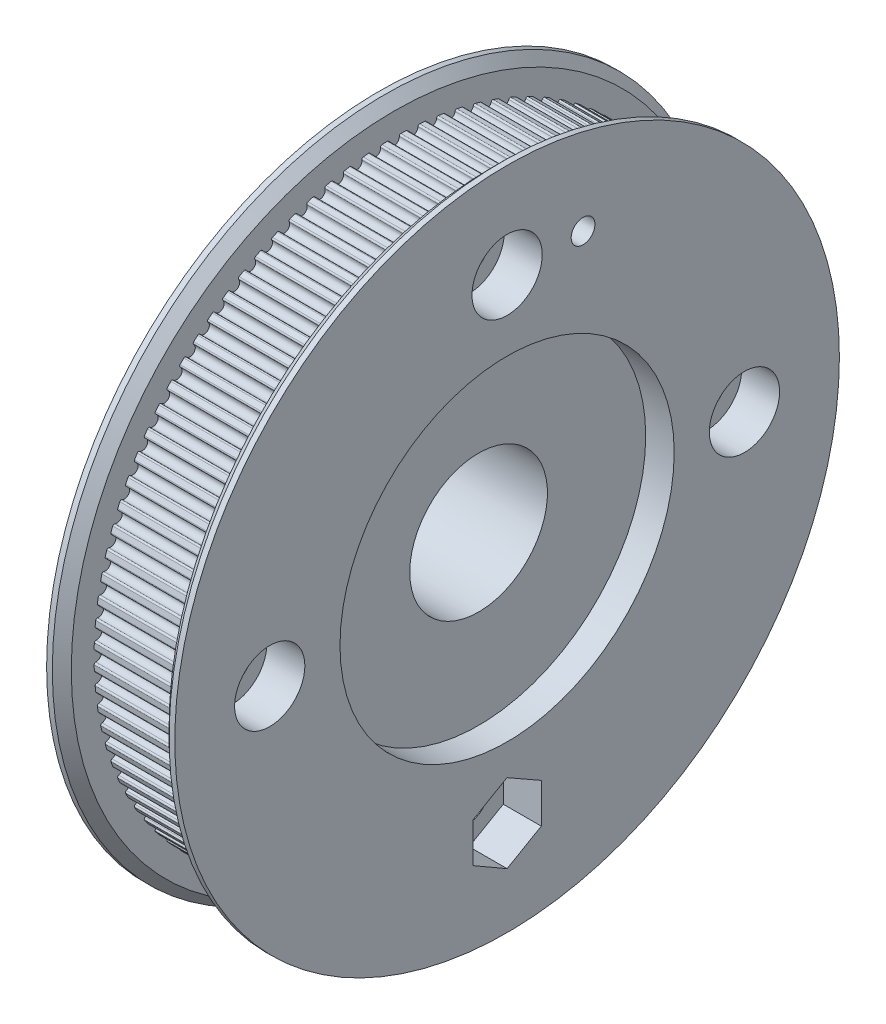
from build123d import *

# Parameters (mm, degrees)
SKETCH1_R           = 31.6
SKETCH1_R_2         = 7.25
BOSS_EXTRUDE1_DEPTH = 10.3
SKETCH2_R           = 0.55
CUT_EXTRUDE1_DEPTH  = 10.3
FILLET1_R           = 0.16
SKETCH3_R           = 35
SKETCH3_R_2         = 7.25
BOSS_EXTRUDE2_DEPTH = 1.6
SKETCH7_R           = 3.7
CUT_EXTRUDE4_DEPTH  = 4
CHAMFER1_SIZE       = 1
SKETCH8_R           = 17.6
CUT_EXTRUDE7_DEPTH  = 3
EXTRUDE_START       = 1.6
SKETCH_1_R          = 35
EXTRUDE_1_DEPTH     = 1.6
CHAMFER_1_SIZE      = 1
SKETCH_2_R          = 2
SKETCH_2_R_2        = 7.25
SKETCH_2_R_3        = 1.25
CUT_EXTRUDE_1_DEPTH = 52.305457799


with BuildPart() as part:
    # Sketch1 → Boss-Extrude1 (new body)
    with BuildSketch(Plane(origin=(0, 0, 0), x_dir=(0, 0, -1), z_dir=(1, 0, 0))):
        with Locations(Location((0, 0, 0), (0, 0, 180))):
            Circle(SKETCH1_R)
        with Locations(Location((0, 0, 0), (0, 0, 180))):
            Circle(SKETCH1_R_2, mode=Mode.SUBTRACT)
    extrude(amount=BOSS_EXTRUDE1_DEPTH)

    # Sketch2 → Cut-Extrude1 (cut)
    with BuildSketch(Plane(origin=(0, 0, 0), x_dir=(0, 0, -1), z_dir=(1, 0, 0))):
        with Locations((0, 31.39)):
            Circle(SKETCH2_R)
        with Locations((1.970994408, 31.328059005)):
            Circle(SKETCH2_R)
        with Locations((3.934210202, 31.142480474)):
            Circle(SKETCH2_R)
        with Locations((5.881899465, 30.8339968)):
            Circle(SKETCH2_R)
        with Locations((7.806375558, 30.403825428)):
            Circle(SKETCH2_R)
        with Locations((9.700043453, 29.853664047)):
            Circle(SKETCH2_R)
        with Locations((11.555429709, 29.185683892)):
            Circle(SKETCH2_R)
        with Locations((13.365211962, 28.402521177)):
            Circle(SKETCH2_R)
        with Locations((15.12224783, 27.507266687)):
            Circle(SKETCH2_R)
        with Locations((16.819603094, 26.503453582)):
            Circle(SKETCH2_R)
        with Locations((18.450579069, 25.395043453)):
            Circle(SKETCH2_R)
        with Locations((20.008739038, 24.186410691)):
            Circle(SKETCH2_R)
        with Locations((21.487933655, 22.882325215)):
            Circle(SKETCH2_R)
        with Locations((22.882325215, 21.487933655)):
            Circle(SKETCH2_R)
        with Locations((24.186410691, 20.008739038)):
            Circle(SKETCH2_R)
        with Locations((25.395043453, 18.450579069)):
            Circle(SKETCH2_R)
        with Locations((26.503453582, 16.819603094)):
            Circle(SKETCH2_R)
        with Locations((27.507266687, 15.12224783)):
            Circle(SKETCH2_R)
        with Locations((28.402521177, 13.365211962)):
            Circle(SKETCH2_R)
        with Locations((29.185683892, 11.555429709)):
            Circle(SKETCH2_R)
        with Locations((29.853664047, 9.700043453)):
            Circle(SKETCH2_R)
        with Locations((30.403825428, 7.806375558)):
            Circle(SKETCH2_R)
        with Locations((30.8339968, 5.881899465)):
            Circle(SKETCH2_R)
        with Locations((31.142480474, 3.934210202)):
            Circle(SKETCH2_R)
        with Locations((31.328059005, 1.970994408)):
            Circle(SKETCH2_R)
        with Locations((31.39, 0)):
            Circle(SKETCH2_R)
        with Locations((31.328059005, -1.970994408)):
            Circle(SKETCH2_R)
        with Locations((31.142480474, -3.934210202)):
            Circle(SKETCH2_R)
        with Locations((30.8339968, -5.881899465)):
            Circle(SKETCH2_R)
        with Locations((30.403825428, -7.806375558)):
            Circle(SKETCH2_R)
        with Locations((29.853664047, -9.700043453)):
            Circle(SKETCH2_R)
        with Locations((29.185683892, -11.555429709)):
            Circle(SKETCH2_R)
        with Locations((28.402521177, -13.365211962)):
            Circle(SKETCH2_R)
        with Locations((27.507266687, -15.12224783)):
            Circle(SKETCH2_R)
        with Locations((26.503453582, -16.819603094)):
            Circle(SKETCH2_R)
        with Locations((25.395043453, -18.450579069)):
            Circle(SKETCH2_R)
        with Locations((24.186410691, -20.008739038)):
            Circle(SKETCH2_R)
        with Locations((22.882325215, -21.487933655)):
            Circle(SKETCH2_R)
        with Locations((21.487933655, -22.882325215)):
            Circle(SKETCH2_R)
        with Locations((20.008739038, -24.186410691)):
            Circle(SKETCH2_R)
        with Locations((18.450579069, -25.395043453)):
            Circle(SKETCH2_R)
        with Locations((16.819603094, -26.503453582)):
            Circle(SKETCH2_R)
        with Locations((15.12224783, -27.507266687)):
            Circle(SKETCH2_R)
        with Locations((13.365211962, -28.402521177)):
            Circle(SKETCH2_R)
        with Locations((11.555429709, -29.185683892)):
            Circle(SKETCH2_R)
        with Locations((9.700043453, -29.853664047)):
            Circle(SKETCH2_R)
        with Locations((7.806375558, -30.403825428)):
            Circle(SKETCH2_R)
        with Locations((5.881899465, -30.8339968)):
            Circle(SKETCH2_R)
        with Locations((3.934210202, -31.142480474)):
            Circle(SKETCH2_R)
        with Locations((1.970994408, -31.328059005)):
            Circle(SKETCH2_R)
        with Locations((0, -31.39)):
            Circle(SKETCH2_R)
        with Locations((-1.970994408, -31.328059005)):
            Circle(SKETCH2_R)
        with Locations((-3.934210202, -31.142480474)):
            Circle(SKETCH2_R)
        with Locations((-5.881899465, -30.8339968)):
            Circle(SKETCH2_R)
        with Locations((-7.806375558, -30.403825428)):
            Circle(SKETCH2_R)
        with Locations((-9.700043453, -29.853664047)):
            Circle(SKETCH2_R)
        with Locations((-11.555429709, -29.185683892)):
            Circle(SKETCH2_R)
        with Locations((-13.365211962, -28.402521177)):
            Circle(SKETCH2_R)
        with Locations((-15.12224783, -27.507266687)):
            Circle(SKETCH2_R)
        with Locations((-16.819603094, -26.503453582)):
            Circle(SKETCH2_R)
        with Locations((-18.450579069, -25.395043453)):
            Circle(SKETCH2_R)
        with Locations((-20.008739038, -24.186410691)):
            Circle(SKETCH2_R)
        with Locations((-21.487933655, -22.882325215)):
            Circle(SKETCH2_R)
        with Locations((-22.882325215, -21.487933655)):
            Circle(SKETCH2_R)
        with Locations((-24.186410691, -20.008739038)):
            Circle(SKETCH2_R)
        with Locations((-25.395043453, -18.450579069)):
            Circle(SKETCH2_R)
        with Locations((-26.503453582, -16.819603094)):
            Circle(SKETCH2_R)
        with Locations((-27.507266687, -15.12224783)):
            Circle(SKETCH2_R)
        with Locations((-28.402521177, -13.365211962)):
            Circle(SKETCH2_R)
        with Locations((-29.185683892, -11.555429709)):
            Circle(SKETCH2_R)
        with Locations((-29.853664047, -9.700043453)):
            Circle(SKETCH2_R)
        with Locations((-30.403825428, -7.806375558)):
            Circle(SKETCH2_R)
        with Locations((-30.8339968, -5.881899465)):
            Circle(SKETCH2_R)
        with Locations((-31.142480474, -3.934210202)):
            Circle(SKETCH2_R)
        with Locations((-31.328059005, -1.970994408)):
            Circle(SKETCH2_R)
        with Locations((-31.39, 0)):
            Circle(SKETCH2_R)
        with Locations((-31.328059005, 1.970994408)):
            Circle(SKETCH2_R)
        with Locations((-31.142480474, 3.934210202)):
            Circle(SKETCH2_R)
        with Locations((-30.8339968, 5.881899465)):
            Circle(SKETCH2_R)
        with Locations((-30.403825428, 7.806375558)):
            Circle(SKETCH2_R)
        with Locations((-29.853664047, 9.700043453)):
            Circle(SKETCH2_R)
        with Locations((-29.185683892, 11.555429709)):
            Circle(SKETCH2_R)
        with Locations((-28.402521177, 13.365211962)):
            Circle(SKETCH2_R)
        with Locations((-27.507266687, 15.12224783)):
            Circle(SKETCH2_R)
        with Locations((-26.503453582, 16.819603094)):
            Circle(SKETCH2_R)
        with Locations((-25.395043453, 18.450579069)):
            Circle(SKETCH2_R)
        with Locations((-24.186410691, 20.008739038)):
            Circle(SKETCH2_R)
        with Locations((-22.882325215, 21.487933655)):
            Circle(SKETCH2_R)
        with Locations((-21.487933655, 22.882325215)):
            Circle(SKETCH2_R)
        with Locations((-20.008739038, 24.186410691)):
            Circle(SKETCH2_R)
        with Locations((-18.450579069, 25.395043453)):
            Circle(SKETCH2_R)
        with Locations((-16.819603094, 26.503453582)):
            Circle(SKETCH2_R)
        with Locations((-15.12224783, 27.507266687)):
            Circle(SKETCH2_R)
        with Locations((-13.365211962, 28.402521177)):
            Circle(SKETCH2_R)
        with Locations((-11.555429709, 29.185683892)):
            Circle(SKETCH2_R)
        with Locations((-9.700043453, 29.853664047)):
            Circle(SKETCH2_R)
        with Locations((-7.806375558, 30.403825428)):
            Circle(SKETCH2_R)
        with Locations((-5.881899465, 30.8339968)):
            Circle(SKETCH2_R)
        with Locations((-3.934210202, 31.142480474)):
            Circle(SKETCH2_R)
        with Locations((-1.970994408, 31.328059005)):
            Circle(SKETCH2_R)
    extrude(amount=CUT_EXTRUDE1_DEPTH, mode=Mode.SUBTRACT)

    # Fillet1
    fillet1_edges = [part.edges().sort_by_distance(p)[0] for p in [
        (5.15, 31.59588404, 0.510011532),
        (5.15, 31.59588404, -0.510011532),
        (5.15, 31.501512891, 2.492927114),
        (5.15, 31.565560669, 1.474916834),
        (5.15, 31.282819662, 4.466004252),
        (5.15, 31.410662451, 3.454024376),
        (5.15, 30.940667436, 6.421456112),
        (5.15, 31.131800699, 5.419500462),
        (5.15, 30.476406531, 8.351565418),
        (5.15, 30.730075952, 7.363588255),
        (5.15, 29.891869173, 10.248714911),
        (5.15, 30.207073634, 9.27861533),
        (5.15, 29.189362264, 12.105417408),
        (5.15, 29.564857798, 11.157023949),
        (5.15, 28.371658277, 13.914345353),
        (5.15, 28.805962974, 12.991400892),
        (5.15, 27.441984317, 15.668359734),
        (5.15, 27.933384175, 14.774506711),
        (5.15, 26.404009381, 17.360538258),
        (5.15, 26.95056507, 16.499304301),
        (5.15, 25.261829884, 18.984202668),
        (5.15, 25.861384397, 18.158986675),
        (5.15, 24.019953484, 20.532945103),
        (5.15, 24.670140655, 19.747003825),
        (5.15, 22.683281303, 22.000653385),
        (5.15, 23.381535138, 21.257088572),
        (5.15, 21.257088572, 23.381535138),
        (5.15, 22.000653385, 22.683281303),
        (5.15, 19.747003825, 24.670140655),
        (5.15, 20.532945103, 24.019953484),
        (5.15, 18.158986675, 25.861384397),
        (5.15, 18.984202668, 25.261829884),
        (5.15, 16.499304301, 26.95056507),
        (5.15, 17.360538258, 26.404009381),
        (5.15, 14.774506711, 27.933384175),
        (5.15, 15.668359734, 27.441984317),
        (5.15, 12.991400892, 28.805962974),
        (5.15, 13.914345353, 28.371658277),
        (5.15, 11.157023949, 29.564857798),
        (5.15, 12.105417408, 29.189362264),
        (5.15, 9.27861533, 30.207073634),
        (5.15, 10.248714911, 29.891869173),
        (5.15, 7.363588255, 30.730075952),
        (5.15, 8.351565418, 30.476406531),
        (5.15, 5.419500462, 31.131800699),
        (5.15, 6.421456112, 30.940667436),
        (5.15, 3.454024376, 31.410662451),
        (5.15, 4.466004252, 31.282819662),
        (5.15, 1.474916834, 31.565560669),
        (5.15, 2.492927114, 31.501512891),
        (5.15, -0.510011532, 31.59588404),
        (5.15, 0.510011532, 31.59588404),
        (5.15, -2.492927114, 31.501512891),
        (5.15, -1.474916834, 31.565560669),
        (5.15, -4.466004252, 31.282819662),
        (5.15, -3.454024376, 31.410662451),
        (5.15, -6.421456112, 30.940667436),
        (5.15, -5.419500462, 31.131800699),
        (5.15, -8.351565418, 30.476406531),
        (5.15, -7.363588255, 30.730075952),
        (5.15, -10.248714911, 29.891869173),
        (5.15, -9.27861533, 30.207073634),
        (5.15, -12.105417408, 29.189362264),
        (5.15, -11.157023949, 29.564857798),
        (5.15, -13.914345353, 28.371658277),
        (5.15, -12.991400892, 28.805962974),
        (5.15, -15.668359734, 27.441984317),
        (5.15, -14.774506711, 27.933384175),
        (5.15, -17.360538258, 26.404009381),
        (5.15, -16.499304301, 26.95056507),
        (5.15, -18.984202668, 25.261829884),
        (5.15, -18.158986675, 25.861384397),
        (5.15, -20.532945103, 24.019953484),
        (5.15, -19.747003825, 24.670140655),
        (5.15, -22.000653385, 22.683281303),
        (5.15, -21.257088572, 23.381535138),
        (5.15, -23.381535138, 21.257088572),
        (5.15, -22.683281303, 22.000653385),
        (5.15, -24.670140655, 19.747003825),
        (5.15, -24.019953484, 20.532945103),
        (5.15, -25.861384397, 18.158986675),
        (5.15, -25.261829884, 18.984202668),
        (5.15, -26.95056507, 16.499304301),
        (5.15, -26.404009381, 17.360538258),
        (5.15, -27.933384175, 14.774506711),
        (5.15, -27.441984317, 15.668359734),
        (5.15, -28.805962974, 12.991400892),
        (5.15, -28.371658277, 13.914345353),
        (5.15, -29.564857798, 11.157023949),
        (5.15, -29.189362264, 12.105417408),
        (5.15, -30.207073634, 9.27861533),
        (5.15, -29.891869173, 10.248714911),
        (5.15, -30.730075952, 7.363588255),
        (5.15, -30.476406531, 8.351565418),
        (5.15, -31.131800699, 5.419500462),
        (5.15, -30.940667436, 6.421456112),
        (5.15, -31.410662451, 3.454024376),
        (5.15, -31.282819662, 4.466004252),
        (5.15, -31.565560669, 1.474916834),
        (5.15, -31.501512891, 2.492927114),
        (5.15, -31.59588404, -0.510011532),
        (5.15, -31.59588404, 0.510011532),
        (5.15, -31.501512891, -2.492927114),
        (5.15, -31.565560669, -1.474916834),
        (5.15, -31.282819662, -4.466004252),
        (5.15, -31.410662451, -3.454024376),
        (5.15, -30.940667436, -6.421456112),
        (5.15, -31.131800699, -5.419500462),
        (5.15, -30.476406531, -8.351565418),
        (5.15, -30.730075952, -7.363588255),
        (5.15, -29.891869173, -10.248714911),
        (5.15, -30.207073634, -9.27861533),
        (5.15, -29.189362264, -12.105417408),
        (5.15, -29.564857798, -11.157023949),
        (5.15, -28.371658277, -13.914345353),
        (5.15, -28.805962974, -12.991400892),
        (5.15, -27.441984317, -15.668359734),
        (5.15, -27.933384175, -14.774506711),
        (5.15, -26.404009381, -17.360538258),
        (5.15, -26.95056507, -16.499304301),
        (5.15, -25.261829884, -18.984202668),
        (5.15, -25.861384397, -18.158986675),
        (5.15, -24.019953484, -20.532945103),
        (5.15, -24.670140655, -19.747003825),
        (5.15, -22.683281303, -22.000653385),
        (5.15, -23.381535138, -21.257088572),
        (5.15, -21.257088572, -23.381535138),
        (5.15, -22.000653385, -22.683281303),
        (5.15, -19.747003825, -24.670140655),
        (5.15, -20.532945103, -24.019953484),
        (5.15, -18.158986675, -25.861384397),
        (5.15, -18.984202668, -25.261829884),
        (5.15, -16.499304301, -26.95056507),
        (5.15, -17.360538258, -26.404009381),
        (5.15, -14.774506711, -27.933384175),
        (5.15, -15.668359734, -27.441984317),
        (5.15, -12.991400892, -28.805962974),
        (5.15, -13.914345353, -28.371658277),
        (5.15, -11.157023949, -29.564857798),
        (5.15, -12.105417408, -29.189362264),
        (5.15, -9.27861533, -30.207073634),
        (5.15, -10.248714911, -29.891869173),
        (5.15, -7.363588255, -30.730075952),
        (5.15, -8.351565418, -30.476406531),
        (5.15, -5.419500462, -31.131800699),
        (5.15, -6.421456112, -30.940667436),
        (5.15, -3.454024376, -31.410662451),
        (5.15, -4.466004252, -31.282819662),
        (5.15, -1.474916834, -31.565560669),
        (5.15, -2.492927114, -31.501512891),
        (5.15, 0.510011532, -31.59588404),
        (5.15, -0.510011532, -31.59588404),
        (5.15, 2.492927114, -31.501512891),
        (5.15, 1.474916834, -31.565560669),
        (5.15, 4.466004252, -31.282819662),
        (5.15, 3.454024376, -31.410662451),
        (5.15, 6.421456112, -30.940667436),
        (5.15, 5.419500462, -31.131800699),
        (5.15, 8.351565418, -30.476406531),
        (5.15, 7.363588255, -30.730075952),
        (5.15, 10.248714911, -29.891869173),
        (5.15, 9.27861533, -30.207073634),
        (5.15, 12.105417408, -29.189362264),
        (5.15, 11.157023949, -29.564857798),
        (5.15, 13.914345353, -28.371658277),
        (5.15, 12.991400892, -28.805962974),
        (5.15, 15.668359734, -27.441984317),
        (5.15, 14.774506711, -27.933384175),
        (5.15, 17.360538258, -26.404009381),
        (5.15, 16.499304301, -26.95056507),
        (5.15, 18.984202668, -25.261829884),
        (5.15, 18.158986675, -25.861384397),
        (5.15, 20.532945103, -24.019953484),
        (5.15, 19.747003825, -24.670140655),
        (5.15, 22.000653385, -22.683281303),
        (5.15, 21.257088572, -23.381535138),
        (5.15, 23.381535138, -21.257088572),
        (5.15, 22.683281303, -22.000653385),
        (5.15, 24.670140655, -19.747003825),
        (5.15, 24.019953484, -20.532945103),
        (5.15, 25.861384397, -18.158986675),
        (5.15, 25.261829884, -18.984202668),
        (5.15, 26.95056507, -16.499304301),
        (5.15, 26.404009381, -17.360538258),
        (5.15, 27.933384175, -14.774506711),
        (5.15, 27.441984317, -15.668359734),
        (5.15, 28.805962974, -12.991400892),
        (5.15, 28.371658277, -13.914345353),
        (5.15, 29.564857798, -11.157023949),
        (5.15, 29.189362264, -12.105417408),
        (5.15, 30.207073634, -9.27861533),
        (5.15, 29.891869173, -10.248714911),
        (5.15, 30.730075952, -7.363588255),
        (5.15, 30.476406531, -8.351565418),
        (5.15, 31.131800699, -5.419500462),
        (5.15, 30.940667436, -6.421456112),
        (5.15, 31.410662451, -3.454024376),
        (5.15, 31.282819662, -4.466004252),
        (5.15, 31.565560669, -1.474916834),
        (5.15, 31.501512891, -2.492927114),
    ]]
    fillet(fillet1_edges, radius=FILLET1_R)

    # Sketch3 → Boss-Extrude2 (add)
    with BuildSketch(Plane(origin=(10.3, 0, 0), x_dir=(0, 0, -1), z_dir=(1, 0, 0))):
        Circle(SKETCH3_R)
        with Locations(Location((0, 0, 0), (0, 0, 180))):
            Circle(SKETCH3_R_2, mode=Mode.SUBTRACT)
    extrude(amount=BOSS_EXTRUDE2_DEPTH)

    # Sketch7 → Cut-Extrude4 (cut)
    with BuildSketch(Plane(origin=(11.9, 0, 0), x_dir=(0, 0, -1), z_dir=(1, 0, 0))):
        with Locations((25, 0)):
            Circle(SKETCH7_R)
        with Locations((-25, 0)):
            Circle(SKETCH7_R)
        with Locations((0, 25)):
            Circle(SKETCH7_R)
        Polygon((-0.01249638, -20.85029285), (-3.6, -22.921539031), (-3.6, -27.078460969), (0, -29.156921938), (3.6, -27.078460969), (3.6, -22.907059191), align=None)
    extrude(amount=-CUT_EXTRUDE4_DEPTH, mode=Mode.SUBTRACT)

    # Chamfer1
    chamfer1_edges = [part.edges().sort_by_distance(p)[0] for p in [
        (10.3, 0, 35),
    ]]
    chamfer(chamfer1_edges, length=CHAMFER1_SIZE)

    # Sketch8 → Cut-Extrude7 (cut)
    with BuildSketch(Plane(origin=(11.9, 0, 0), x_dir=(0, 0, -1), z_dir=(1, 0, 0))):
        Circle(SKETCH8_R)
    extrude(amount=-CUT_EXTRUDE7_DEPTH, mode=Mode.SUBTRACT)

    # 草图1 → 凸台-拉伸1 (add)
    with BuildSketch(Plane.ZY.offset(EXTRUDE_START)):
        with Locations(Location((0, 0, 0), (0, 0, 180))):
            Circle(SKETCH_1_R)
    extrude(amount=-EXTRUDE_1_DEPTH)

    # 倒角1
    chamfer_1_edges = [part.edges().sort_by_distance(p)[0] for p in [
        (0, 0, 35),
    ]]
    chamfer(chamfer_1_edges, length=CHAMFER_1_SIZE)

    # 草图2 → 切除-拉伸1 (cut, through all)
    with BuildSketch(Plane.ZY.offset(1.6)):
        with Locations((0, -25)):
            Circle(SKETCH_2_R)
        with Locations((-25, 0)):
            Circle(SKETCH_2_R)
        with Locations((25, 0)):
            Circle(SKETCH_2_R)
        with Locations((0, 25)):
            Circle(SKETCH_2_R)
        Circle(SKETCH_2_R_2)
        with Locations((-8, 25)):
            Circle(SKETCH_2_R_3)
    extrude(amount=-CUT_EXTRUDE_1_DEPTH, mode=Mode.SUBTRACT)


solid = part.part
